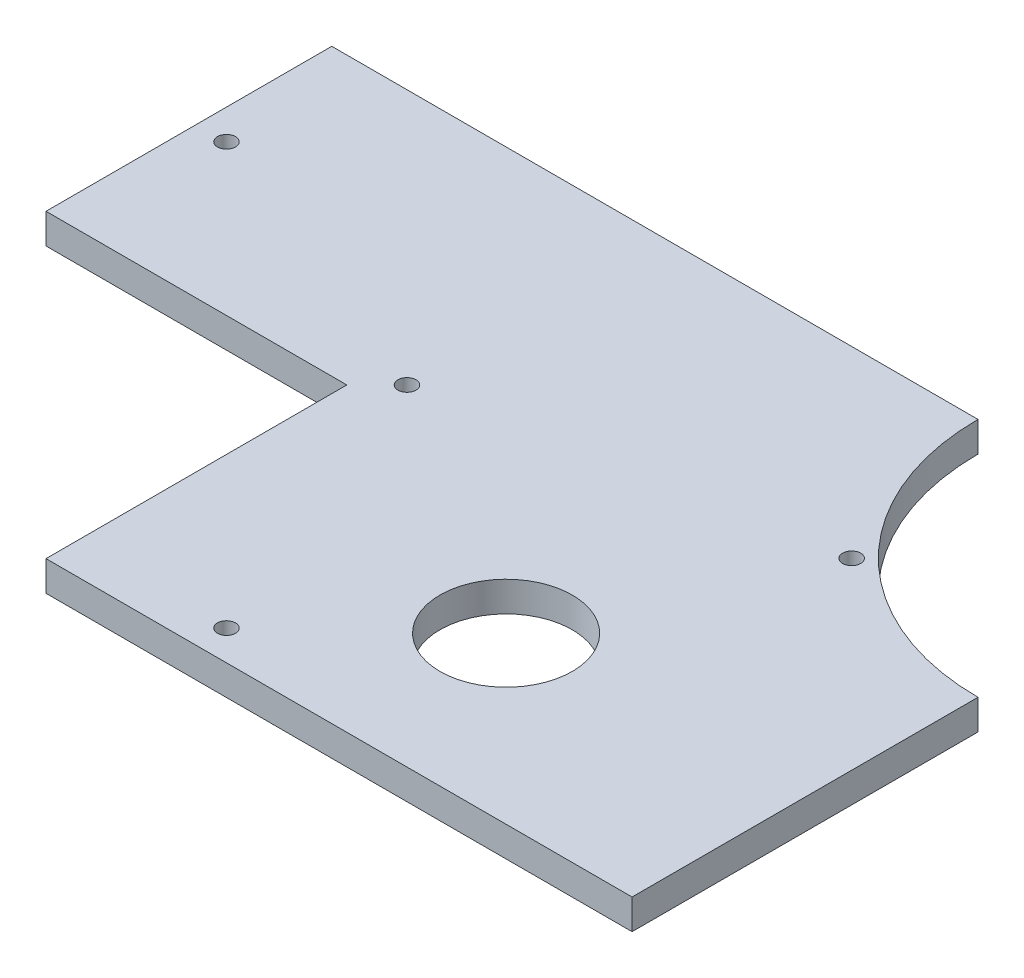
from build123d import *

# Parameters (mm, degrees)
ESQUISSE1_R        = 1.5
ESQUISSE1_R_2      = 11
BOSS_EXTRU_1_DEPTH = 5


with BuildPart() as part:
    # Esquisse1 → Boss.-Extru.1 (new body)
    with BuildSketch(Plane(origin=(0, 0, 0), x_dir=(1, 0, 0), z_dir=(0, 1, 0))):
        with BuildLine():
            Line((-97.415, -97.5), (0, -97.5))
            Line((0, -97.5), (0, -40))
            ThreePointArc((0, -40), (-28.284271247, -28.284271247), (-40, 0))
            Line((-40, 0), (-147.415, 0))
            Line((-147.415, 0), (-147.415, -47.5))
            Line((-147.415, -47.5), (-97.415, -47.5))
            Line((-97.415, -47.5), (-97.415, -97.5))
        make_face()
        with Locations((-72.415, -92.5)):
            Circle(ESQUISSE1_R, mode=Mode.SUBTRACT)
        with Locations((-48.43544943, -70)):
            Circle(ESQUISSE1_R_2, mode=Mode.SUBTRACT)
        with Locations((-92.415, -42.5)):
            Circle(ESQUISSE1_R, mode=Mode.SUBTRACT)
        with Locations((-142.415, -22.5)):
            Circle(ESQUISSE1_R, mode=Mode.SUBTRACT)
        with Locations((-30.501044058, -30.501044058)):
            Circle(ESQUISSE1_R, mode=Mode.SUBTRACT)
    extrude(amount=BOSS_EXTRU_1_DEPTH)


solid = part.part
